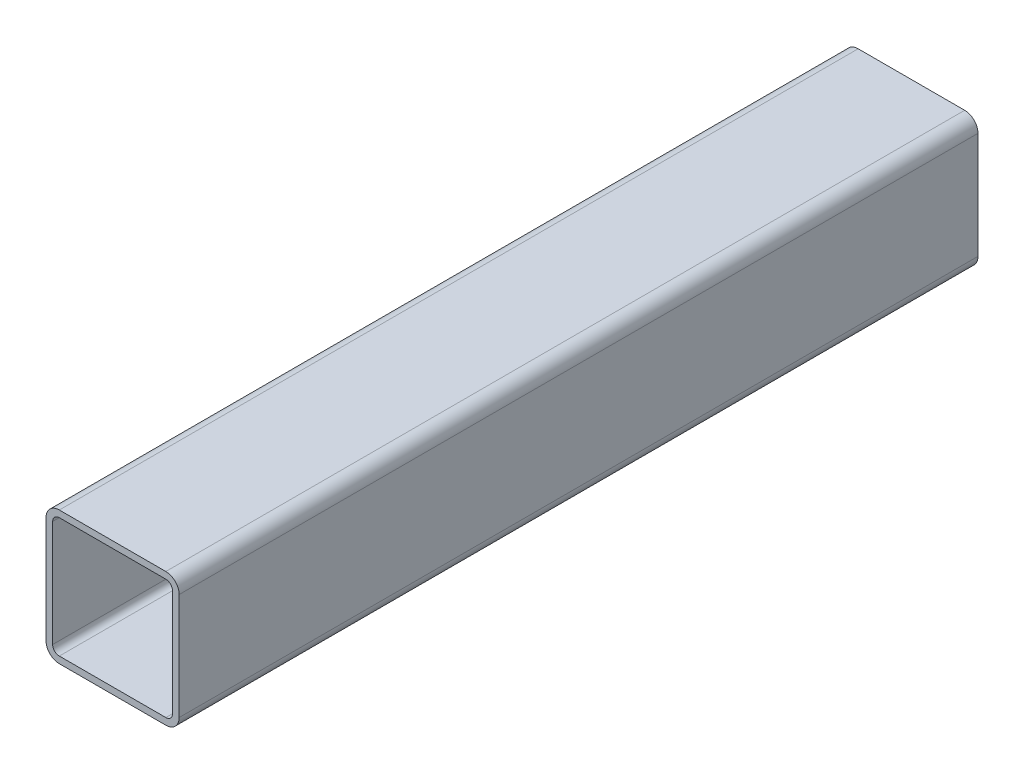
from build123d import *

# Parameters (mm, degrees)
BOSS_EXTRUDE1_DEPTH = 600


with BuildPart() as part:
    # Sketch1 → Boss-Extrude1 (new body)
    with BuildSketch(Plane.XY):
        with BuildLine():
            Line((-40, -50), (40, -50))
            ThreePointArc((40, -50), (47.071067812, -47.071067812), (50, -40))
            Line((50, -40), (50, 40))
            ThreePointArc((50, 40), (47.071067812, 47.071067812), (40, 50))
            Line((40, 50), (-40, 50))
            ThreePointArc((-40, 50), (-47.071067812, 47.071067812), (-50, 40))
            Line((-50, 40), (-50, -40))
            ThreePointArc((-50, -40), (-47.071067812, -47.071067812), (-40, -50))
        make_face()
        with BuildLine():
            Line((-40, 45), (40, 45))
            ThreePointArc((40, 45), (43.535533906, 43.535533906), (45, 40))
            Line((45, 40), (45, -40))
            ThreePointArc((45, -40), (43.535533906, -43.535533906), (40, -45))
            Line((40, -45), (-40, -45))
            ThreePointArc((-40, -45), (-43.535533906, -43.535533906), (-45, -40))
            Line((-45, -40), (-45, 40))
            ThreePointArc((-45, 40), (-43.535533906, 43.535533906), (-40, 45))
        make_face(mode=Mode.SUBTRACT)
    extrude(amount=BOSS_EXTRUDE1_DEPTH)


solid = part.part
